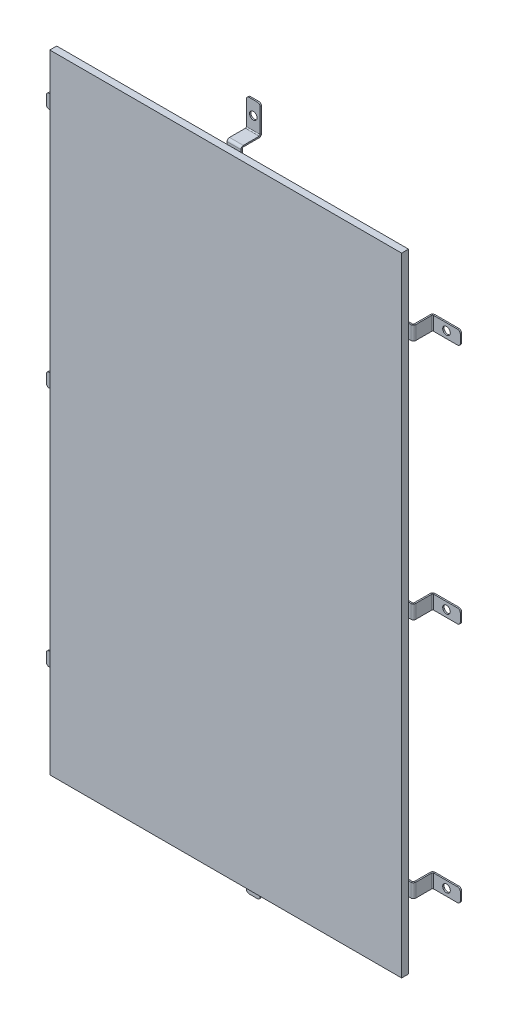
from build123d import *

# Parameters (mm, degrees)
SKETCH1_W                   = 255
SKETCH1_H                   = 455
BOSS_EXTRUDE1_DEPTH         = 5
SKETCH5_R                   = 2.75
BASE_FLANGE1_DEPTH          = 1
JOG1_START                  = 145
JOG1_DEPTH                  = 10
JOG1_START_2                = 147
JOG1_2_DEPTH                = 6
JOG1_START_3                = -7.7366
JOG1_3_DEPTH                = 1.714034452
JOG1_START_4                = -20
JOG1_4_OUTLINE_W            = 2
JOG1_4_OUTLINE_H            = 1
JOG1_4_DEPTH                = 12.375497288
JOG1_START_5                = -7
JOG1_5_DEPTH                = 1
JOG1_6_DEPTH                = 10
JOG1_7_DEPTH                = 10
SKETCH13_R                  = 3.5
BOSS_EXTRUDE2_DEPTH         = 1
BODY_MOVE_COPY1_START       = -6
BODY_MOVE_COPY1_OUTLINE_R   = 3.5
BODY_MOVE_COPY1_DEPTH       = 1
BODY_MOVE_COPY1_START_2     = -19.2634
BODY_MOVE_COPY1_2_OUTLINE_W = 10
BODY_MOVE_COPY1_2_OUTLINE_H = 1
BODY_MOVE_COPY1_2_DEPTH     = 11.5268
BODY_MOVE_COPY1_START_3     = -21
BODY_MOVE_COPY1_3_OUTLINE_R = 2.75
BODY_MOVE_COPY1_3_DEPTH     = 1.7366
BODY_MOVE_COPY1_START_4     = -7.7366
BODY_MOVE_COPY1_4_OUTLINE_R = 2.75
BODY_MOVE_COPY1_4_DEPTH     = 1.7366
BODY_MOVE_COPY1_START_5     = 145
BODY_MOVE_COPY1_5_DEPTH     = 10
BODY_MOVE_COPY2_ANGLE       = 90
BODY_MOVE_COPY2_2_ANGLE     = 90
LPATTERN1_COUNT             = 2
LPATTERN1_PITCH             = 175


with BuildPart() as part:
    # Sketch1 → Boss-Extrude1 (new body)
    with BuildSketch(Plane.XY):
        with Locations((150, 250)):
            Rectangle(SKETCH1_W, SKETCH1_H)
    extrude(amount=-BOSS_EXTRUDE1_DEPTH)


with BuildPart() as body_2:
    # Base-Flange1: sheet metal written as solids
    # Sketch5 → Base-Flange1 (new body)
    with BuildSketch(Plane(origin=(0, 0, -20), x_dir=(-1, 0, 0), z_dir=(0, 0, -1))):
        with BuildLine():
            Line((-147, 0), (-153, 0))
            ThreePointArc((-153, 0), (-154.414213562, 0.585786438), (-155, 2))
            Line((-155, 2), (-155, 32))
            ThreePointArc((-155, 32), (-154.414213562, 33.414213562), (-153, 34))
            Line((-153, 34), (-147, 34))
            ThreePointArc((-147, 34), (-145.585786438, 33.414213562), (-145, 32))
            Line((-145, 32), (-145, 2))
            ThreePointArc((-145, 2), (-145.585786438, 0.585786438), (-147, 0))
        make_face()
        with Locations(Location((-150, 10, 0), (0, 0, 90))):
            Circle(SKETCH5_R, mode=Mode.SUBTRACT)
    extrude(amount=BASE_FLANGE1_DEPTH)

    # Jog1: read off the stored shape, not the designer's step
    # Jog1 outline → Jog1 (cut)
    with BuildSketch(Plane.YZ.offset(JOG1_START)):
        with BuildLine():
            Line((34, -20), (20.83604109, -20))
            ThreePointArc((20.83604109, -20), (20.195226164, -20.728828115), (19.2634, -21))
            Line((19.2634, -21), (34, -21))
            Line((34, -21), (34, -20))
        make_face()
    extrude(amount=JOG1_DEPTH, mode=Mode.SUBTRACT)

    # Jog1 2 outline → Jog1 2 (add)
    with BuildSketch(Plane.YZ.offset(JOG1_START_2)):
        with BuildLine():
            Line((20, -7.7366), (20, -19.2634))
            ThreePointArc((20, -19.2634), (19.784254855, -19.784254855), (19.2634, -20))
            Line((19.2634, -20), (20.83604109, -20))
            ThreePointArc((20.83604109, -20), (20.958514757, -19.640713558), (21, -19.2634))
            Line((21, -19.2634), (21, -7.7366))
            ThreePointArc((21, -7.7366), (21.215745145, -7.215745145), (21.7366, -7))
            Line((21.7366, -7), (34, -7))
            Line((34, -7), (34, -6))
            Line((34, -6), (21.7366, -6))
            ThreePointArc((21.7366, -6), (20.508638364, -6.508638364), (20, -7.7366))
        make_face()
    extrude(amount=JOG1_2_DEPTH)

    # Jog1 3 outline → Jog1 3 (add)
    with BuildSketch(Plane.XY.offset(JOG1_START_3)):
        with BuildLine():
            Line((153, 20), (155, 20))
            Line((155, 20), (155, 32))
            ThreePointArc((155, 32), (154.414213562, 33.414213562), (153, 34))
            Line((153, 34), (153, 20))
        make_face()
        with BuildLine():
            Line((145, 20), (147, 20))
            Line((147, 20), (147, 34))
            ThreePointArc((147, 34), (145.585786438, 33.414213562), (145, 32))
            Line((145, 32), (145, 20))
        make_face()
    extrude(amount=JOG1_3_DEPTH)

    # Jog1 4 outline → Jog1 4 (add)
    with BuildSketch(Plane.XY.offset(JOG1_START_4)):
        with Locations((154, 20.5)):
            Rectangle(JOG1_4_OUTLINE_W, JOG1_4_OUTLINE_H)
        with Locations((146, 20.5)):
            Rectangle(JOG1_4_OUTLINE_W, JOG1_4_OUTLINE_H)
    extrude(amount=JOG1_4_DEPTH)

    # Jog1 5 outline → Jog1 5 (add)
    with BuildSketch(Plane.XY.offset(JOG1_START_5)):
        with BuildLine():
            Line((153, 21), (155, 21))
            Line((155, 21), (155, 32))
            ThreePointArc((155, 32), (154.414213562, 33.414213562), (153, 34))
            Line((153, 34), (153, 21))
        make_face()
        with BuildLine():
            Line((145, 21), (147, 21))
            Line((147, 21), (147, 34))
            ThreePointArc((147, 34), (145.585786438, 33.414213562), (145, 32))
            Line((145, 32), (145, 21))
        make_face()
    extrude(amount=JOG1_5_DEPTH)

    # Jog1 6 outline → Jog1 6 (cut)
    with BuildSketch(Plane.YZ.offset(JOG1_START)):
        with BuildLine():
            ThreePointArc((21, -19.2634), (20.958514757, -19.640713558), (20.83604109, -20))
            ThreePointArc((20.83604109, -20), (20.491361635, -20.491361637), (19.999999998, -20.836041092))
            Line((19.999999998, -20.836041092), (19.999999995, -21))
            Line((19.999999995, -21), (36, -21))
            Line((36, -21), (36, -7))
            Line((36, -7), (21.7366, -7))
            ThreePointArc((21.7366, -7), (21.215745145, -7.215745145), (21, -7.7366))
            Line((21, -7.7366), (21, -19.2634))
        make_face()
        with BuildLine():
            Line((21, -6), (21, -6.022565548))
            Line((21, -6.022565548), (20, -6.022565548))
            Line((20, -6.022565548), (20, -7.7366))
            ThreePointArc((20, -7.7366), (20.508638364, -6.508638364), (21.7366, -6))
            Line((21.7366, -6), (36, -5.999999994))
            Line((36, -5.999999994), (36, -4))
            Line((36, -4), (21.000000006, -4))
            Line((21.000000006, -4), (21, -6))
        make_face()
    extrude(amount=JOG1_6_DEPTH, mode=Mode.SUBTRACT)

    # Jog1 7 outline → Jog1 7 (add)
    with BuildSketch(Plane.YZ.offset(JOG1_START)):
        with BuildLine():
            ThreePointArc((19.2634, -21), (19.640713557, -20.958514757), (19.999999998, -20.836041092))
            Line((19.999999998, -20.836041092), (19.999999995, -20))
            Line((19.999999995, -20), (20, -19.2634))
            ThreePointArc((20, -19.2634), (19.784254855, -19.784254855), (19.2634, -20))
            Line((19.2634, -20), (18, -20))
            Line((18, -20), (18, -21))
            Line((18, -21), (19.2634, -21))
        make_face()
    extrude(amount=JOG1_7_DEPTH)


with BuildPart() as body_3:
    # Sketch13 → Boss-Extrude2 (new body)
    with BuildSketch(Plane.XY.offset(-6)):
        with Locations((150, 26.8683)):
            Circle(SKETCH13_R)
    extrude(amount=BOSS_EXTRUDE2_DEPTH)


with BuildPart() as body_4:
    # Body-Move/Copy1: read off the stored shape, not the designer's step
    # Body-Move/Copy1 outline → Body-Move/Copy1 (new body)
    with BuildSketch(Plane.XY.offset(BODY_MOVE_COPY1_START)):
        with Locations((150, 26.8683)):
            Circle(BODY_MOVE_COPY1_OUTLINE_R)
    extrude(amount=BODY_MOVE_COPY1_DEPTH)


with BuildPart() as body_5:
    # Body-Move_Copy1 2 outline → Body-Move_Copy1 2 (new body)
    with BuildSketch(Plane.XY.offset(BODY_MOVE_COPY1_START_2)):
        with Locations((150, 20.5)):
            Rectangle(BODY_MOVE_COPY1_2_OUTLINE_W, BODY_MOVE_COPY1_2_OUTLINE_H)
    extrude(amount=BODY_MOVE_COPY1_2_DEPTH)

    # Body-Move_Copy1 3 outline → Body-Move_Copy1 3 (add)
    with BuildSketch(Plane.XY.offset(BODY_MOVE_COPY1_START_3)):
        with BuildLine():
            Line((155, 2), (155, 32))
            ThreePointArc((155, 32), (154.414213562, 33.414213562), (153, 34))
            Line((153, 34), (147, 34))
            ThreePointArc((147, 34), (145.585786438, 33.414213562), (145, 32))
            Line((145, 32), (145, 2))
            ThreePointArc((145, 2), (145.585786438, 0.585786438), (147, 0))
            Line((147, 0), (153, 0))
            ThreePointArc((153, 0), (154.414213562, 0.585786438), (155, 2))
        make_face()
        with Locations((150, 10)):
            Circle(BODY_MOVE_COPY1_3_OUTLINE_R, mode=Mode.SUBTRACT)
    extrude(amount=BODY_MOVE_COPY1_3_DEPTH)

    # Body-Move_Copy1 4 outline → Body-Move_Copy1 4 (add)
    with BuildSketch(Plane.XY.offset(BODY_MOVE_COPY1_START_4)):
        with BuildLine():
            Line((155, 2), (155, 32))
            ThreePointArc((155, 32), (154.414213562, 33.414213562), (153, 34))
            Line((153, 34), (147, 34))
            ThreePointArc((147, 34), (145.585786438, 33.414213562), (145, 32))
            Line((145, 32), (145, 2))
            ThreePointArc((145, 2), (145.585786438, 0.585786438), (147, 0))
            Line((147, 0), (153, 0))
            ThreePointArc((153, 0), (154.414213562, 0.585786438), (155, 2))
        make_face()
        with Locations((150, 10)):
            Circle(BODY_MOVE_COPY1_4_OUTLINE_R, mode=Mode.SUBTRACT)
    extrude(amount=BODY_MOVE_COPY1_4_DEPTH)

    # Body-Move_Copy1 5 outline → Body-Move_Copy1 5 (cut)
    with BuildSketch(Plane.YZ.offset(BODY_MOVE_COPY1_START_5)):
        with BuildLine():
            Line((0, -19.2634), (0, -20))
            Line((0, -20), (19.2634, -20))
            ThreePointArc((19.2634, -20), (19.784254855, -19.784254855), (20, -19.2634))
            Line((20, -19.2634), (0, -19.2634))
        make_face()
        with BuildLine():
            ThreePointArc((21, -19.2634), (20.491361636, -20.491361636), (19.2634, -21))
            Line((19.2634, -21), (34, -21))
            Line((34, -21), (34, -19.2634))
            Line((34, -19.2634), (21, -19.2634))
        make_face()
        with BuildLine():
            Line((34, -7), (21.7366, -7))
            ThreePointArc((21.7366, -7), (21.215745145, -7.215745145), (21, -7.7366))
            Line((21, -7.7366), (34, -7.7366))
            Line((34, -7.7366), (34, -7))
        make_face()
        with BuildLine():
            ThreePointArc((20, -7.7366), (20.508638364, -6.508638364), (21.7366, -6))
            Line((21.7366, -6), (0, -6))
            Line((0, -6), (0, -7.7366))
            Line((0, -7.7366), (20, -7.7366))
        make_face()
    extrude(amount=BODY_MOVE_COPY1_5_DEPTH, mode=Mode.SUBTRACT)


with BuildPart() as body_3_1:
    # Body-Move/Copy2: read off the stored shape, not the designer's step
    # Body-Move/Copy2: moved
    add(body_3.part.moved(Location((-75, -300, 0))).rotate(Axis((0, 0, 0), (0, 0, 1)), BODY_MOVE_COPY2_ANGLE))


with BuildPart() as body_2_1:
    # Body-Move_Copy2 2: moved
    add(body_2.part.moved(Location((-75, -300, 0))).rotate(Axis((0, 0, 0), (0, 0, 1)), BODY_MOVE_COPY2_2_ANGLE))


with BuildPart() as body_6:
    # Mirror1: mirrored copy
    add(body_5.part.mirror(Plane(origin=(0, 250, 0), x_dir=(0, 0, 1), z_dir=(0, -1, 0))))


with BuildPart() as body_7:
    # Mirror1 2: mirrored copy
    add(body_4.part.mirror(Plane(origin=(0, 250, 0), x_dir=(0, 0, 1), z_dir=(0, -1, 0))))


with BuildPart() as body_8:
    # Mirror3: mirrored copy
    add(body_2_1.part.mirror(Plane(origin=(0, 250, 0), x_dir=(0, 0, 1), z_dir=(0, -1, 0))))


with BuildPart() as body_9:
    # Mirror3 2: mirrored copy
    add(body_3_1.part.mirror(Plane(origin=(0, 250, 0), x_dir=(0, 0, 1), z_dir=(0, -1, 0))))


with BuildPart() as lpattern1_1:
    # LPattern1: pattern copy
    add(body_3_1.part.moved(Location(Vector(0, 1, 0) * (1 * LPATTERN1_PITCH))))


with BuildPart() as lpattern1_2:
    # LPattern1: pattern copy
    add(body_2_1.part.moved(Location(Vector(0, 1, 0) * (1 * LPATTERN1_PITCH))))


with BuildPart() as body_12:
    # Mirror4: mirrored copy
    add(body_2_1.part.mirror(Plane.ZY.offset(-150)))


with BuildPart() as body_13:
    # Mirror4 2: mirrored copy
    add(lpattern1_2.part.mirror(Plane.ZY.offset(-150)))


with BuildPart() as body_14:
    # Mirror4 3: mirrored copy
    add(body_8.part.mirror(Plane.ZY.offset(-150)))


with BuildPart() as body_15:
    # Mirror4 4: mirrored copy
    add(body_3_1.part.mirror(Plane.ZY.offset(-150)))


with BuildPart() as body_16:
    # Mirror4 5: mirrored copy
    add(lpattern1_1.part.mirror(Plane.ZY.offset(-150)))


with BuildPart() as body_17:
    # Mirror4 6: mirrored copy
    add(body_9.part.mirror(Plane.ZY.offset(-150)))


solid = Compound([part.part, body_4.part, body_5.part, body_3_1.part, body_2_1.part, body_6.part, body_7.part, body_8.part, body_9.part, lpattern1_1.part, lpattern1_2.part, body_12.part, body_13.part, body_14.part, body_15.part, body_16.part, body_17.part])
